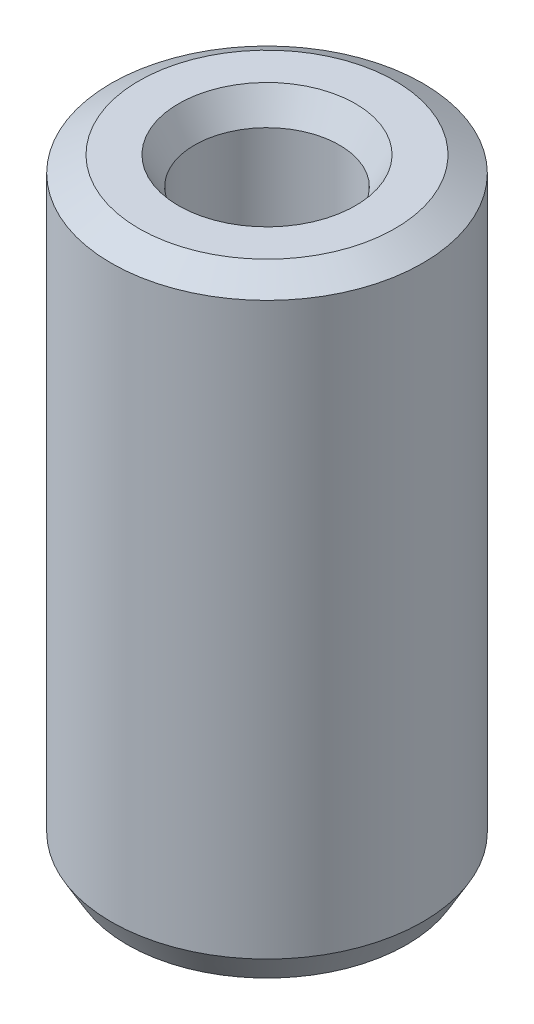
from build123d import *
from OCP.BRepFilletAPI import BRepFilletAPI_MakeChamfer

# Parameters (mm, degrees)
SKETCH1_R           = 5
BOSS_EXTRUDE1_DEPTH = 19.71415877
SKETCH2_R           = 2.323604827
CUT_EXTRUDE1_DEPTH  = 21.943926471
CHAMFER1_SIZE       = 0.514924996
CHAMFER1_SIZE2      = 0.891876255


with BuildPart() as part:
    # Sketch1 → Boss-Extrude1 (new body)
    with BuildSketch(Plane(origin=(0, 0, 0), x_dir=(1, 0, 0), z_dir=(0, 1, 0))):
        Circle(SKETCH1_R)
    extrude(amount=BOSS_EXTRUDE1_DEPTH)

    # Sketch2 → Cut-Extrude1 (cut, through all)
    with BuildSketch(Plane(origin=(0, 0, 0), x_dir=(1, 0, 0), z_dir=(0, 1, 0))):
        Circle(SKETCH2_R)
    extrude(amount=CUT_EXTRUDE1_DEPTH, mode=Mode.SUBTRACT)

    # Chamfer1: one chamfer whose edges measure the first distance from different faces: ONE call of the kernel's chamfer builder (chamfer() names one face for all edges)
    chamfer1_edges_1 = [part.edges().sort_by_distance(p)[0] for p in [
        (-2.323604827, 19.71415877, 0),
    ]]
    chamfer1_side_1 = [part.faces().sort_by_distance(p)[0] for p in [
        (-4.858578644, 19.71415877, 0),
    ]]
    chamfer1_edges_2 = [part.edges().sort_by_distance(p)[0] for p in [
        (-2.323604827, 0, 0),
    ]]
    chamfer1_side_2 = [part.faces().sort_by_distance(p)[0] for p in [
        (-2.323604827, 9.857079385, 0),
    ]]
    chamfer1_edges_3 = [part.edges().sort_by_distance(p)[0] for p in [
        (-5, 0, 0),
    ]]
    chamfer1_side_3 = [part.faces().sort_by_distance(p)[0] for p in [
        (-4.858578644, 0, 0),
    ]]
    chamfer1_edges_4 = [part.edges().sort_by_distance(p)[0] for p in [
        (-5, 19.71415877, 0),
    ]]
    chamfer1_side_4 = [part.faces().sort_by_distance(p)[0] for p in [
        (-5, 9.857079385, 0),
    ]]
    chamfer1 = BRepFilletAPI_MakeChamfer(part.part.solid().wrapped)
    for e in chamfer1_edges_1:
        chamfer1.Add(CHAMFER1_SIZE, CHAMFER1_SIZE2, e.wrapped, chamfer1_side_1[0].wrapped)  # the first distance lies on this face
    for e in chamfer1_edges_2:
        chamfer1.Add(CHAMFER1_SIZE, CHAMFER1_SIZE2, e.wrapped, chamfer1_side_2[0].wrapped)  # the first distance lies on this face
    for e in chamfer1_edges_3:
        chamfer1.Add(CHAMFER1_SIZE, CHAMFER1_SIZE2, e.wrapped, chamfer1_side_3[0].wrapped)  # the first distance lies on this face
    for e in chamfer1_edges_4:
        chamfer1.Add(CHAMFER1_SIZE, CHAMFER1_SIZE2, e.wrapped, chamfer1_side_4[0].wrapped)  # the first distance lies on this face
    add(Compound.cast(chamfer1.Shape()), mode=Mode.REPLACE)


solid = part.part
